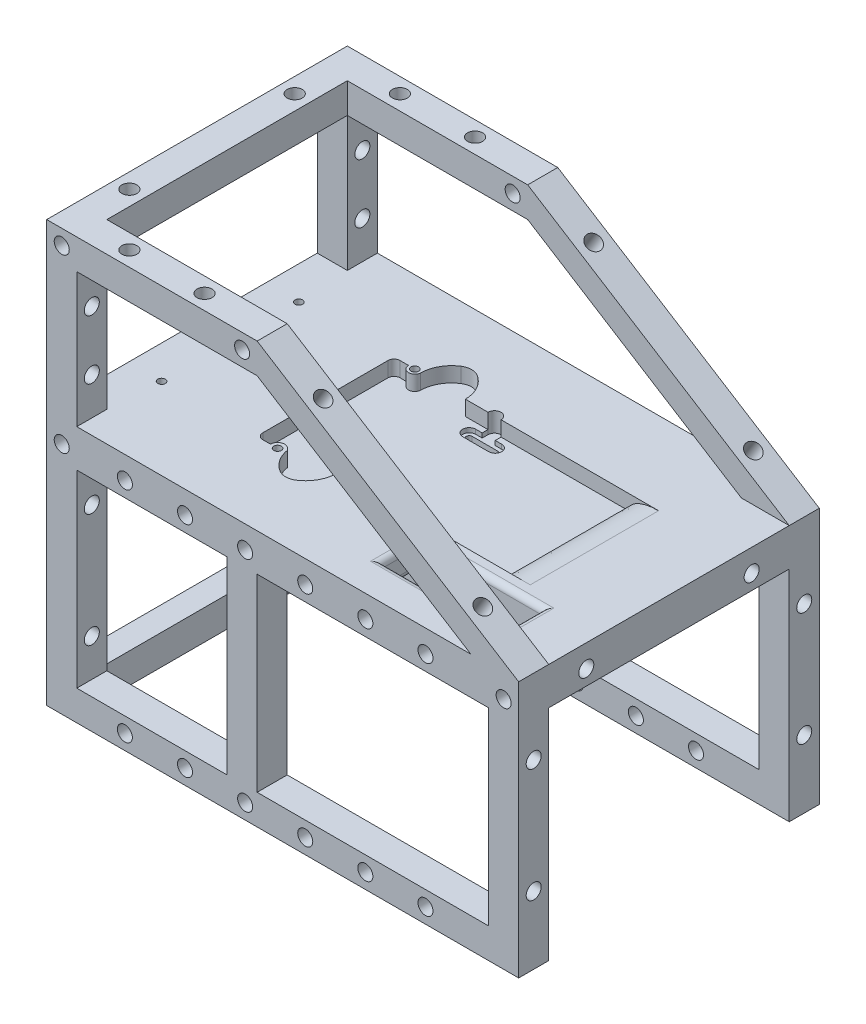
from build123d import *

# Parameters (mm, degrees)
SKETCH1_W                = 199.39
SKETCH1_H                = 127
BOSS_EXTRUDE1_DEPTH      = 12.7
SKETCH2_W                = 12.7
SKETCH2_H                = 12.7
BOSS_EXTRUDE2_DEPTH      = 95.674999912
SKETCH3_W                = 199.39
SKETCH3_H                = 127
SKETCH3_W_2              = 173.99
SKETCH3_H_2              = 101.6
BOSS_EXTRUDE4_DEPTH      = 15.875
SKETCH4_W                = 12.7
SKETCH4_H                = 12.7
BOSS_EXTRUDE5_DEPTH      = 177.8
BOSS_EXTRUDE6_DEPTH      = 12.7
SKETCH7_W                = 101.6
SKETCH7_H                = 12.7
CUT_EXTRUDE1_DEPTH       = 15.875
SKETCH8_W                = 101.6
SKETCH8_H                = 12.7
CUT_EXTRUDE2_DEPTH       = 2.54
SKETCH9_R                = 3.175
CUT_EXTRUDE3_DEPTH       = 296.800967037
SKETCH24_W               = 199.39
SKETCH24_H               = 11.43
BOSS_EXTRUDE8_DEPTH      = 101.6
SKETCH10_R               = 3.175
CUT_EXTRUDE4_DEPTH       = 15.875
CUT_EXTRUDE5_START       = -15.875
SKETCH11_R               = 3.175
CUT_EXTRUDE5_DEPTH       = 15.875
SKETCH12_R               = 3.175
CUT_EXTRUDE6_DEPTH       = 15.875
SKETCH15_R               = 3.175
CUT_EXTRUDE7_DEPTH       = 15.875
SKETCH16_R               = 3.175
CUT_EXTRUDE8_DEPTH       = 15.875
CUT_EXTRUDE11_START      = -15.875
SKETCH20_R               = 3.175
CUT_EXTRUDE11_DEPTH      = 15.875
SKETCH25_R               = 1.6
CUT_EXTRUDE12_DEPTH      = 11.43
SKETCH26_W               = 50.8
SKETCH26_H               = 16.51
CUT_EXTRUDE13_DEPTH      = 240.390794948
FILLET2_R                = 2.54
SKETCH28_W               = 101.6
SKETCH28_H               = 4.445
CUT_EXTRUDE14_DEPTH      = 6.35
SKETCH29_W               = 12.7
SKETCH29_H               = 56.725000088
CUT_EXTRUDE15_DEPTH      = 296.800967037
BOSS_EXTRUDE9_DEPTH      = 12.7
BOSS_EXTRUDE10_DEPTH     = 12.7
SKETCH32_R               = 3.175
CUT_EXTRUDE16_DEPTH      = 12.7
SKETCH34_W               = 88
SKETCH34_H               = 54.249999962
CUT_EXTRUDE18_DEPTH      = 6.35
CUT_EXTRUDE19_DEPTH      = 6.35
FILLET3_SIZE             = 12.7
FILLET3_SIZE_2           = 6.35
CUT_EXTRUDE20_DEPTH      = 240.390794948
CUT_EXTRUDE20_DEPTH_BACK = 240.390794948
CUT_EXTRUDE21_DEPTH      = 1.87797624
CUT_EXTRUDE22_DEPTH      = 8.22797624
SKETCH43_R               = 2.54
CUT_EXTRUDE23_DEPTH      = 8.255
CUT_EXTRUDE25_DEPTH      = 6.35


with BuildPart() as part:
    # Sketch1 → Boss-Extrude1 (new body)
    with BuildSketch(Plane(origin=(0, 0, 0), x_dir=(1, 0, 0), z_dir=(0, 1, 0))):
        with Locations((99.695, -12.7)):
            Rectangle(SKETCH1_W, SKETCH1_H)
        Polygon((12.7, -12.7), (12.7, 38.1), (186.69, 38.1), (186.69, -63.5), (12.7, -63.5), align=None, mode=Mode.SUBTRACT)
    extrude(amount=BOSS_EXTRUDE1_DEPTH)

    # Sketch2 → Boss-Extrude2 (add)
    with BuildSketch(Plane(origin=(0, 12.7, 0), x_dir=(1, 0, 0), z_dir=(0, 1, 0))):
        with Locations((6.35, 44.45)):
            Rectangle(SKETCH2_W, SKETCH2_H)
        with Locations((193.04, 44.45)):
            Rectangle(SKETCH2_W, SKETCH2_H)
        with Locations((193.04, -69.85)):
            Rectangle(SKETCH2_W, SKETCH2_H)
        with Locations((6.35, -69.85)):
            Rectangle(SKETCH2_W, SKETCH2_H)
    extrude(amount=BOSS_EXTRUDE2_DEPTH)

    # Sketch3 → Boss-Extrude4 (add)
    with BuildSketch(Plane(origin=(0, 108.374999912, 0), x_dir=(1, 0, 0), z_dir=(0, 1, 0))):
        with Locations((99.695, -12.7)):
            Rectangle(SKETCH3_W, SKETCH3_H)
        with Locations((99.695, -12.7)):
            Rectangle(SKETCH3_W_2, SKETCH3_H_2, mode=Mode.SUBTRACT)
    extrude(amount=-BOSS_EXTRUDE4_DEPTH)

    # Sketch4 → Boss-Extrude5 (add)
    with BuildSketch(Plane.XZ):
        with Locations((6.35, 69.85)):
            Rectangle(SKETCH4_W, SKETCH4_H)
        with Locations((6.35, -44.45)):
            Rectangle(SKETCH4_W, SKETCH4_H)
        with Locations((82.55, -44.45)):
            Rectangle(SKETCH4_W, SKETCH4_H)
        with Locations((82.55, 69.85)):
            Rectangle(SKETCH4_W, SKETCH4_H)
    extrude(amount=-BOSS_EXTRUDE5_DEPTH)

    # Sketch5 → Boss-Extrude6 (add)
    with BuildSketch(Plane(origin=(0, 177.8, 0), x_dir=(1, 0, 0), z_dir=(0, 1, 0))):
        Polygon((88.9, 50.8), (0, 50.8), (0, -76.2), (88.9, -76.2), (88.9, -63.5), (12.7, -63.5), (12.7, 38.1), (88.9, 38.1), align=None)
    extrude(amount=-BOSS_EXTRUDE6_DEPTH)

    # Sketch7 → Cut-Extrude1 (cut)
    with BuildSketch(Plane(origin=(199.39, 0, 0), x_dir=(0, 0, -1), z_dir=(1, 0, 0))):
        with Locations((-12.7, 6.35)):
            Rectangle(SKETCH7_W, SKETCH7_H)
    extrude(amount=-CUT_EXTRUDE1_DEPTH, mode=Mode.SUBTRACT)

    # Sketch8 → Cut-Extrude2 (cut)
    with BuildSketch(Plane(origin=(12.7, 0, 0), x_dir=(0, 0, -1), z_dir=(1, 0, 0))):
        with Locations((-12.7, 6.35)):
            Rectangle(SKETCH8_W, SKETCH8_H)
    extrude(amount=-CUT_EXTRUDE2_DEPTH, mode=Mode.SUBTRACT)

    # Sketch9 → Cut-Extrude3 (cut, through all)
    with BuildSketch(Plane.XY.offset(76.2)):
        with Locations((33.02, 98.849999912)):
            Circle(SKETCH9_R)
        with Locations((58.42, 98.849999912)):
            Circle(SKETCH9_R)
        with Locations((83.82, 98.849999912)):
            Circle(SKETCH9_R)
        with Locations((109.22, 98.849999912)):
            Circle(SKETCH9_R)
        with Locations((134.62, 98.849999912)):
            Circle(SKETCH9_R)
        with Locations((160.02, 98.849999912)):
            Circle(SKETCH9_R)
        with Locations((33.02, 6.35)):
            Circle(SKETCH9_R)
        with Locations((58.42, 6.35)):
            Circle(SKETCH9_R)
        with Locations((83.82, 6.35)):
            Circle(SKETCH9_R)
        with Locations((109.22, 6.35)):
            Circle(SKETCH9_R)
        with Locations((134.62, 6.35)):
            Circle(SKETCH9_R)
        with Locations((160.02, 6.35)):
            Circle(SKETCH9_R)
    extrude(amount=-CUT_EXTRUDE3_DEPTH, mode=Mode.SUBTRACT)

    # Sketch24 → Boss-Extrude8 (add)
    with BuildSketch(Plane(origin=(0, 0, 63.5), x_dir=(-1, 0, 0), z_dir=(0, 0, -1))):
        with Locations((-99.695, 102.659999912)):
            Rectangle(SKETCH24_W, SKETCH24_H)
    extrude(amount=BOSS_EXTRUDE8_DEPTH)

    # Sketch10 → Cut-Extrude4 (cut)
    with BuildSketch(Plane.XY.offset(76.2)):
        with Locations((6.35, 98.849999912)):
            Circle(SKETCH10_R)
        with Locations((6.35, 171.45)):
            Circle(SKETCH10_R)
        with Locations((82.55, 171.45)):
            Circle(SKETCH10_R)
        with Locations((193.04, 98.849999912)):
            Circle(SKETCH10_R)
    extrude(amount=-CUT_EXTRUDE4_DEPTH, mode=Mode.SUBTRACT)

    # Sketch11 → Cut-Extrude5 (cut)
    with BuildSketch(Plane(origin=(0, 0, -50.8), x_dir=(-1, 0, 0), z_dir=(0, 0, -1)).offset(CUT_EXTRUDE5_START)):
        with Locations(Location((-6.35, 98.849999912, 0), (0, 0, 180))):
            Circle(SKETCH11_R)
        with Locations(Location((-6.35, 171.45, 0), (0, 0, 180))):
            Circle(SKETCH11_R)
        with Locations(Location((-82.55, 171.45, 0), (0, 0, 180))):
            Circle(SKETCH11_R)
        with Locations(Location((-193.04, 98.849999912, 0), (0, 0, 180))):
            Circle(SKETCH11_R)
    extrude(amount=CUT_EXTRUDE5_DEPTH, mode=Mode.SUBTRACT)

    # Sketch12 → Cut-Extrude6 (cut)
    with BuildSketch(Plane.ZY):
        with Locations((-44.45, 28.575)):
            Circle(SKETCH12_R)
        with Locations((-44.45, 76.624999912)):
            Circle(SKETCH12_R)
        with Locations((-44.45, 124.249999912)):
            Circle(SKETCH12_R)
        with Locations((-44.45, 149.225)):
            Circle(SKETCH12_R)
        with Locations(Location((69.85, 149.225, 0), (0, 0, 180))):
            Circle(SKETCH12_R)
        with Locations(Location((69.85, 124.249999912, 0), (0, 0, 180))):
            Circle(SKETCH12_R)
        with Locations((69.85, 76.624999912)):
            Circle(SKETCH12_R)
        with Locations((69.85, 28.575)):
            Circle(SKETCH12_R)
    extrude(amount=-CUT_EXTRUDE6_DEPTH, mode=Mode.SUBTRACT)

    # Sketch15 → Cut-Extrude7 (cut)
    with BuildSketch(Plane.XZ):
        with Locations(Location((6.35, 69.85, 0), (0, 0, 270))):
            Circle(SKETCH15_R)
        with Locations(Location((193.04, 69.85, 0), (0, 0, 270))):
            Circle(SKETCH15_R)
        with Locations(Location((6.35, -44.45, 0), (0, 0, 270))):
            Circle(SKETCH15_R)
        with Locations(Location((193.04, -44.45, 0), (0, 0, 270))):
            Circle(SKETCH15_R)
    extrude(amount=-CUT_EXTRUDE7_DEPTH, mode=Mode.SUBTRACT)

    # Sketch16 → Cut-Extrude8 (cut)
    with BuildSketch(Plane(origin=(0, 177.8, 0), x_dir=(1, 0, 0), z_dir=(0, 1, 0))):
        with Locations(Location((28.575, 44.45, 0), (0, 0, 270))):
            Circle(SKETCH16_R)
        with Locations(Location((60.325, 44.45, 0), (0, 0, 270))):
            Circle(SKETCH16_R)
        with Locations(Location((6.35, 22.225, 0), (0, 0, 270))):
            Circle(SKETCH16_R)
        with Locations(Location((6.35, -47.625, 0), (0, 0, 270))):
            Circle(SKETCH16_R)
        with Locations(Location((60.325, -69.85, 0), (0, 0, 270))):
            Circle(SKETCH16_R)
        with Locations(Location((28.575, -69.85, 0), (0, 0, 270))):
            Circle(SKETCH16_R)
    extrude(amount=-CUT_EXTRUDE8_DEPTH, mode=Mode.SUBTRACT)

    # Sketch20 → Cut-Extrude11 (cut)
    with BuildSketch(Plane(origin=(199.39, 0, 0), x_dir=(0, 0, -1), z_dir=(1, 0, 0)).offset(CUT_EXTRUDE11_START)):
        with Locations(Location((-69.85, 28.575, 0), (0, 0, 180))):
            Circle(SKETCH20_R)
        with Locations(Location((-69.85, 76.624999912, 0), (0, 0, 180))):
            Circle(SKETCH20_R)
        with Locations((-47.625, 98.849999912)):
            Circle(SKETCH20_R)
        with Locations(Location((22.225, 98.849999912, 0), (0, 0, 323.130102354))):
            Circle(SKETCH20_R)
        with Locations(Location((44.45, 76.624999912, 0), (0, 0, 180))):
            Circle(SKETCH20_R)
        with Locations(Location((44.45, 28.575, 0), (0, 0, 180))):
            Circle(SKETCH20_R)
    extrude(amount=CUT_EXTRUDE11_DEPTH, mode=Mode.SUBTRACT)

    # Sketch25 → Cut-Extrude12 (cut)
    with BuildSketch(Plane(origin=(0, 108.374999912, 0), x_dir=(1, 0, 0), z_dir=(0, 1, 0))):
        with Locations(Location((63.0230116, 16.3, 0), (0, 0, 270))):
            Circle(SKETCH25_R)
        with Locations(Location((63.0230116, -41.7, 0), (0, 0, 270))):
            Circle(SKETCH25_R)
        with Locations(Location((14.0230116, -41.7, 0), (0, 0, 270))):
            Circle(SKETCH25_R)
        with Locations(Location((14.0230116, 16.3, 0), (0, 0, 270))):
            Circle(SKETCH25_R)
    extrude(amount=-CUT_EXTRUDE12_DEPTH, mode=Mode.SUBTRACT)

    # Sketch26 → Cut-Extrude13 (cut, through all)
    with BuildSketch(Plane(origin=(0, 108.374999912, 0), x_dir=(1, 0, 0), z_dir=(0, 1, 0))):
        with Locations((151.9230116, -52.6)):
            Rectangle(SKETCH26_W, SKETCH26_H)
    extrude(amount=-CUT_EXTRUDE13_DEPTH, mode=Mode.SUBTRACT)

    # Fillet2
    fillet2_edges = [part.edges().sort_by_distance(p)[0] for p in [
        (126.5230116, 96.944999912, 52.6),
        (177.3230116, 108.374999912, 52.6),
        (151.9230116, 108.374999912, 44.345),
        (126.5230116, 108.374999912, 52.6),
        (151.9230116, 108.374999912, 60.855),
    ]]
    fillet(fillet2_edges, radius=FILLET2_R)

    # Sketch28 → Cut-Extrude14 (cut)
    with BuildSketch(Plane(origin=(12.7, 0, 0), x_dir=(0, 0, -1), z_dir=(1, 0, 0))):
        with Locations((-12.7, 94.722499912)):
            Rectangle(SKETCH28_W, SKETCH28_H)
    extrude(amount=-CUT_EXTRUDE14_DEPTH, mode=Mode.SUBTRACT)

    # Sketch29 → Cut-Extrude15 (cut, through all)
    with BuildSketch(Plane.XY.offset(76.2)):
        with Locations((82.55, 136.737499956)):
            Rectangle(SKETCH29_W, SKETCH29_H)
    extrude(amount=-CUT_EXTRUDE15_DEPTH, mode=Mode.SUBTRACT)

    # Sketch30 → Boss-Extrude9 (add)
    with BuildSketch(Plane.XY.offset(76.2)):
        Polygon((88.9, 177.8), (199.39, 108.374999912), (179.177929446, 108.374999912), (88.9, 165.1), align=None)
    extrude(amount=-BOSS_EXTRUDE9_DEPTH)

    # Sketch31 → Boss-Extrude10 (add)
    with BuildSketch(Plane(origin=(0, 0, -50.8), x_dir=(-1, 0, 0), z_dir=(0, 0, -1))):
        Polygon((-88.9, 177.8), (-88.9, 165.1), (-179.177929446, 108.374999912), (-199.39, 108.374999912), align=None)
    extrude(amount=-BOSS_EXTRUDE10_DEPTH)

    # Sketch32 → Cut-Extrude16 (cut)
    with BuildSketch(Plane(origin=(105.259522338, 167.520700156, 0), x_dir=(0.8467258159330607, -0.5320295035357462, 0), z_dir=(0.5320295035357462, 0.8467258159330607, 0))):
        with Locations(Location((6.079079308, 44.45, 0), (0, 0, 180))):
            Circle(SKETCH32_R)
        with Locations(Location((85.76996304, 44.45, 0), (0, 0, 180))):
            Circle(SKETCH32_R)
        with Locations((85.76996304, -69.85)):
            Circle(SKETCH32_R)
        with Locations((6.079079308, -69.85)):
            Circle(SKETCH32_R)
    extrude(amount=-CUT_EXTRUDE16_DEPTH, mode=Mode.SUBTRACT)

    # Sketch34 → Cut-Extrude18 (cut)
    with BuildSketch(Plane(origin=(0, 108.374999912, 0), x_dir=(1, 0, 0), z_dir=(0, 1, 0))):
        with Locations((109.663011654, -11.175000019)):
            Rectangle(SKETCH34_W, SKETCH34_H)
    extrude(amount=-CUT_EXTRUDE18_DEPTH, mode=Mode.SUBTRACT)

    # Sketch35 → Cut-Extrude19 (cut)
    with BuildSketch(Plane(origin=(0, 108.374999912, 0), x_dir=(1, 0, 0), z_dir=(0, 1, 0))):
        with BuildLine():
            Line((65.663011654, 15.949999962), (84.713011654, 15.949999962))
            ThreePointArc((84.713011654, 15.949999962), (83.086591701, 22.305086066), (78.607242423, 27.097558424))
            ThreePointArc((78.607242423, 27.097558424), (75.188011654, 28.096730362), (71.768780885, 27.097558424))
            ThreePointArc((71.768780885, 27.097558424), (67.289431607, 22.305086066), (65.663011654, 15.949999962))
        make_face()
        with BuildLine():
            Line((65.663011654, -38.3), (84.713011654, -38.3))
            ThreePointArc((84.713011654, -38.3), (83.086591701, -44.655086104), (78.607242423, -49.447558462))
            ThreePointArc((78.607242423, -49.447558462), (75.188011654, -50.4467304), (71.768780885, -49.447558462))
            ThreePointArc((71.768780885, -49.447558462), (67.289431607, -44.655086104), (65.663011654, -38.3))
        make_face()
    extrude(amount=-CUT_EXTRUDE19_DEPTH, mode=Mode.SUBTRACT)

    # Fillet3
    # an asymmetric fillet: 12.7, 6.35 mm, written as the material it takes off along each edge
    with BuildSketch(Plane(origin=(153.663011654, 108.374999912, -15.949999962), x_dir=(1, 0, 0), z_dir=(0, 0, 1))) as fillet3_piece_1:
        with BuildLine():
            Bezier((FILLET3_SIZE, 0), (0, 0), (0, -FILLET3_SIZE_2), weights=[1, 0.707106781, 1])
            Line((0, -FILLET3_SIZE_2), (0, 0))
            Line((0, 0), (FILLET3_SIZE, 0))
        make_face()
    extrude(amount=54.249999962, mode=Mode.SUBTRACT)

    # Sketch38 → Cut-Extrude20 (cut, two sides: drawn at the far end of the back side and taken through both)
    with BuildSketch(Plane(origin=(0, 108.374999912, 0), x_dir=(1, 0, 0), z_dir=(0, 1, 0)).offset(-CUT_EXTRUDE20_DEPTH_BACK)):
        with BuildLine():
            Line((91.533011654, -32.000000004), (102.533011654, -32.000000004))
            ThreePointArc((102.533011654, -32.000000004), (103.783011654, -33.250000004), (102.533011654, -34.500000004))
            Line((102.533011654, -34.500000004), (91.533011654, -34.500000004))
            ThreePointArc((91.533011654, -34.500000004), (90.283011654, -33.250000004), (91.533011654, -32.000000004))
        make_face()
        with BuildLine():
            Line((91.533011654, 11.999999996), (102.533011654, 11.999999996))
            ThreePointArc((102.533011654, 11.999999996), (103.783011654, 10.749999996), (102.533011654, 9.499999996))
            Line((102.533011654, 9.499999996), (91.533011654, 9.499999996))
            ThreePointArc((91.533011654, 9.499999996), (90.283011654, 10.749999996), (91.533011654, 11.999999996))
        make_face()
    extrude(amount=CUT_EXTRUDE20_DEPTH + CUT_EXTRUDE20_DEPTH_BACK, mode=Mode.SUBTRACT)

    # Sketch41 → Cut-Extrude21 (cut)
    with BuildSketch(Plane(origin=(0, 102.024999912, 0), x_dir=(1, 0, 0), z_dir=(0, 1, 0))):
        with BuildLine():
            Line((91.533011654, -30.500000004), (102.533011654, -30.500000004))
            ThreePointArc((102.533011654, -30.500000004), (105.283011654, -33.250000004), (102.533011654, -36.000000004))
            Line((102.533011654, -36.000000004), (91.533011654, -36.000000004))
            ThreePointArc((91.533011654, -36.000000004), (88.783011654, -33.250000004), (91.533011654, -30.500000004))
        make_face()
        with BuildLine():
            Line((91.533011654, 13.499999996), (102.533011654, 13.499999996))
            ThreePointArc((102.533011654, 13.499999996), (105.283011654, 10.749999996), (102.533011654, 7.999999996))
            Line((102.533011654, 7.999999996), (91.533011654, 7.999999996))
            ThreePointArc((91.533011654, 7.999999996), (88.783011654, 10.749999996), (91.533011654, 13.499999996))
        make_face()
    extrude(amount=-CUT_EXTRUDE21_DEPTH, mode=Mode.SUBTRACT)

    # Sketch42 → Cut-Extrude22 (cut)
    with BuildSketch(Plane(origin=(0, 108.374999912, 0), x_dir=(1, 0, 0), z_dir=(0, 1, 0))):
        with BuildLine():
            Line((94.283011654, -38.3), (94.283011654, -36.000000004))
            Line((94.283011654, -36.000000004), (99.783011654, -36.000000004))
            Line((99.783011654, -36.000000004), (99.783011654, -38.3))
            ThreePointArc((99.783011654, -38.3), (97.033011654, -41.05), (94.283011654, -38.3))
        make_face()
        with BuildLine():
            Line((99.783011654, 13.649999966), (99.783011654, 15.949999962))
            ThreePointArc((99.783011654, 15.949999962), (97.033011654, 18.699999962), (94.283011654, 15.949999962))
            Line((94.283011654, 15.949999962), (94.283011654, 13.649999966))
            Line((94.283011654, 13.649999966), (94.283011654, 13.499999996))
            Line((94.283011654, 13.499999996), (99.783011654, 13.499999996))
            Line((99.783011654, 13.499999996), (99.783011654, 13.649999966))
        make_face()
    extrude(amount=-CUT_EXTRUDE22_DEPTH, mode=Mode.SUBTRACT)

    # Sketch43 → Cut-Extrude23 (cut)
    with BuildSketch(Plane.XZ.offset(-96.944999912)):
        with Locations(Location((63.0230116, 41.7, 0), (0, 0, 270))):
            Circle(SKETCH43_R)
        with Locations(Location((63.0230116, -16.3, 0), (0, 0, 270))):
            Circle(SKETCH43_R)
        with Locations(Location((14.0230116, -16.3, 0), (0, 0, 270))):
            Circle(SKETCH43_R)
        with Locations(Location((14.0230116, 41.7, 0), (0, 0, 270))):
            Circle(SKETCH43_R)
    extrude(amount=-CUT_EXTRUDE23_DEPTH, mode=Mode.SUBTRACT)

    # Sketch45 → Cut-Extrude25 (cut)
    with BuildSketch(Plane(origin=(0, 108.374999912, 0), x_dir=(1, 0, 0), z_dir=(0, 1, 0))):
        with BuildLine():
            Line((65.663011654, -38.3), (65.663011654, 15.949999962))
            ThreePointArc((65.663011654, 15.949999962), (62.847630855, 13.642681444), (60.359911844, 16.3))
            Line((60.359911844, 16.3), (56.773011654, 16.3))
            ThreePointArc((56.773011654, 16.3), (54.97696043, 15.556051224), (54.233011654, 13.76))
            Line((54.233011654, 13.76), (54.233011654, -39.144658444))
            ThreePointArc((54.233011654, -39.144658444), (54.982376274, -40.946109231), (56.788306879, -41.684612392))
            Line((56.788306879, -41.684612392), (60.023072442, -41.665133114))
            ThreePointArc((60.023072442, -41.665133114), (62.304917542, -38.787064783), (65.663011654, -40.274780589))
            Line((65.663011654, -40.274780589), (65.907458019, -40.274780589))
            Line((65.907458019, -40.274780589), (65.663011654, -38.3))
        make_face()
    extrude(amount=-CUT_EXTRUDE25_DEPTH, mode=Mode.SUBTRACT)


solid = part.part
